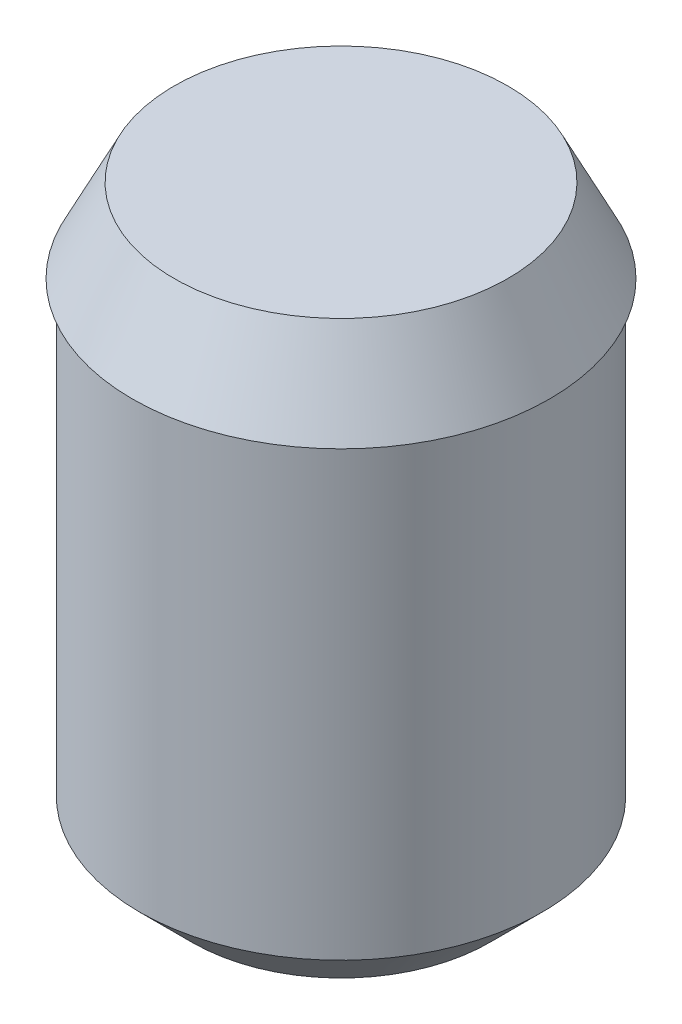
from build123d import *


# Read off the part's stored shape, not the designer's step: #10-24 机械螺纹 螺柱1
with BuildPart() as part:
    # 草图1 → 旋转1 (revolve)
    with BuildSketch(Plane.XY, mode=Mode.PRIVATE) as revolve_1_sk:
        Polygon((0, 0), (0, 7), (-2, 7), (-2.5, 6), (-2.5, 0), align=None)
    revolve(revolve_1_sk.sketch.rotate(Axis((0, 0, 0), (0, 1, 0)), 270), axis=Axis((0, 0, 0), (0, 1, 0)))

    # #10-24 机械螺纹 螺柱1 outline → #10-24 机械螺纹 螺柱1 (revolve, cut)
    with BuildSketch(Plane.XY):
        Polygon((1.78308, 0), (2.5, 0), (2.5, 6), (2.413, 6), (2.413, 0.62992), align=None)
    revolve(axis=Axis((0, 0, 0), (0, 1, 0)), mode=Mode.SUBTRACT)


solid = part.part
